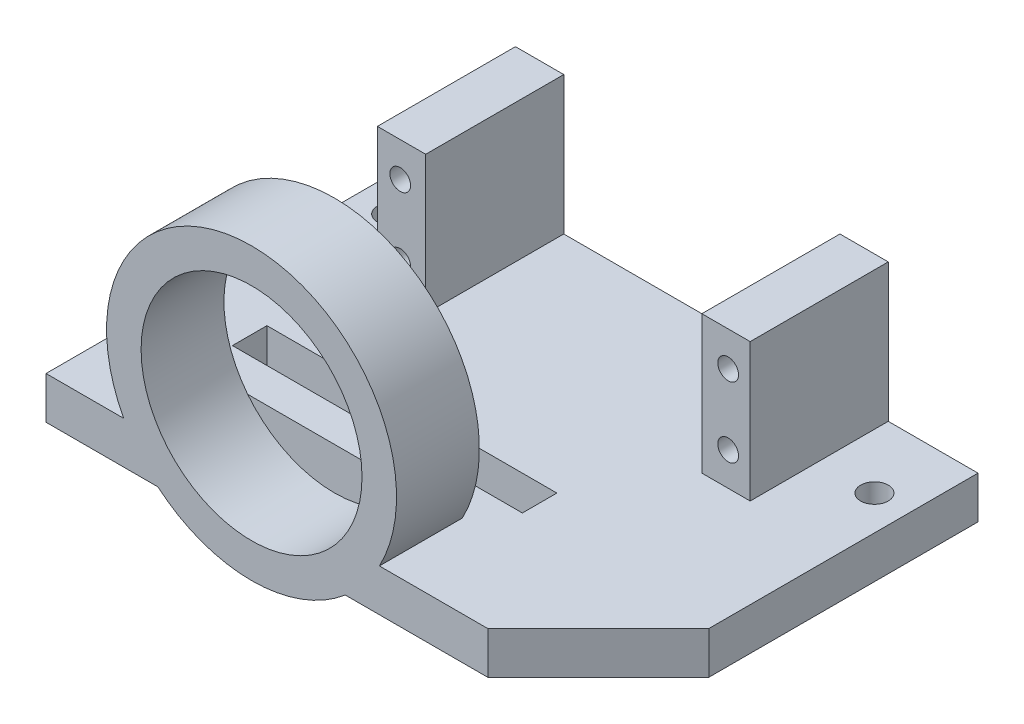
from build123d import *

# Parameters (mm, degrees)
SKETCH1_W           = 80
SKETCH1_H           = 20
BOSS_EXTRUDE1_DEPTH = 6.12
SKETCH14_R          = 2
CUT_EXTRUDE7_DEPTH  = 22.92
SKETCH2_W           = 7
SKETCH2_H           = 20
BOSS_EXTRUDE2_DEPTH = 20
SKETCH3_W           = 80
SKETCH3_H           = 6.12
BOSS_EXTRUDE3_DEPTH = 35
SKETCH5_R           = 21
BOSS_EXTRUDE4_DEPTH = 12
SKETCH4_R           = 16
CUT_EXTRUDE1_DEPTH  = 12
SKETCH7_R           = 1.5
CUT_EXTRUDE2_DEPTH  = 12
SKETCH8_W           = 42
SKETCH8_H           = 5
CUT_EXTRUDE3_DEPTH  = 12
CUT_EXTRUDE4_DEPTH  = 10


with BuildPart() as part:
    # Sketch1 → Boss-Extrude1 (new body)
    with BuildSketch(Plane(origin=(0, 0, 0), x_dir=(1, 0, 0), z_dir=(0, 1, 0))):
        with Locations((40, 10)):
            Rectangle(SKETCH1_W, SKETCH1_H)
    extrude(amount=BOSS_EXTRUDE1_DEPTH)

    # Sketch14 → Cut-Extrude7 (cut)
    with BuildSketch(Plane(origin=(0, 6.12, 0), x_dir=(1, 0, 0), z_dir=(0, 1, 0))):
        with Locations((75, 10)):
            Circle(SKETCH14_R)
        with Locations((5, 10)):
            Circle(SKETCH14_R)
    extrude(amount=-CUT_EXTRUDE7_DEPTH, mode=Mode.SUBTRACT)

    # Sketch2 → Boss-Extrude2 (add)
    with BuildSketch(Plane(origin=(0, 6.12, 0), x_dir=(1, 0, 0), z_dir=(0, 1, 0))):
        with Locations((16.5, 10)):
            Rectangle(SKETCH2_W, SKETCH2_H)
        with Locations((63.5, 10)):
            Rectangle(SKETCH2_W, SKETCH2_H)
    extrude(amount=BOSS_EXTRUDE2_DEPTH)

    # Sketch3 → Boss-Extrude3 (add)
    with BuildSketch(Plane.XY):
        with Locations((40, 3.06)):
            Rectangle(SKETCH3_W, SKETCH3_H)
    extrude(amount=BOSS_EXTRUDE3_DEPTH)

    # Sketch5 → Boss-Extrude4 (add)
    with BuildSketch(Plane.XY.offset(35)):
        with Locations((29.774, 16.026)):
            Circle(SKETCH5_R)
    extrude(amount=-BOSS_EXTRUDE4_DEPTH)

    # Sketch4 → Cut-Extrude1 (cut)
    with BuildSketch(Plane.XY.offset(35)):
        with Locations((29.774, 16.026)):
            Circle(SKETCH4_R)
    extrude(amount=-CUT_EXTRUDE1_DEPTH, mode=Mode.SUBTRACT)

    # Sketch7 → Cut-Extrude2 (cut)
    with BuildSketch(Plane.XY):
        with Locations((16.312, 21.106)):
            Circle(SKETCH7_R)
        with Locations((16.312, 10.946)):
            Circle(SKETCH7_R)
        with Locations((63.81, 10.946)):
            Circle(SKETCH7_R)
        with Locations((63.81, 21.106)):
            Circle(SKETCH7_R)
    extrude(amount=-CUT_EXTRUDE2_DEPTH, mode=Mode.SUBTRACT)

    # Sketch8 → Cut-Extrude3 (cut)
    with BuildSketch(Plane(origin=(0, 6.12, 0), x_dir=(1, 0, 0), z_dir=(0, 1, 0))):
        with Locations((31, -15.5)):
            Rectangle(SKETCH8_W, SKETCH8_H)
    extrude(amount=-CUT_EXTRUDE3_DEPTH, mode=Mode.SUBTRACT)

    # Sketch9 → Cut-Extrude4 (cut)
    with BuildSketch(Plane(origin=(0, 6.12, 0), x_dir=(1, 0, 0), z_dir=(0, 1, 0))):
        Polygon((80, -19), (64, -35), (80, -35), align=None)
    extrude(amount=-CUT_EXTRUDE4_DEPTH, mode=Mode.SUBTRACT)


solid = part.part
